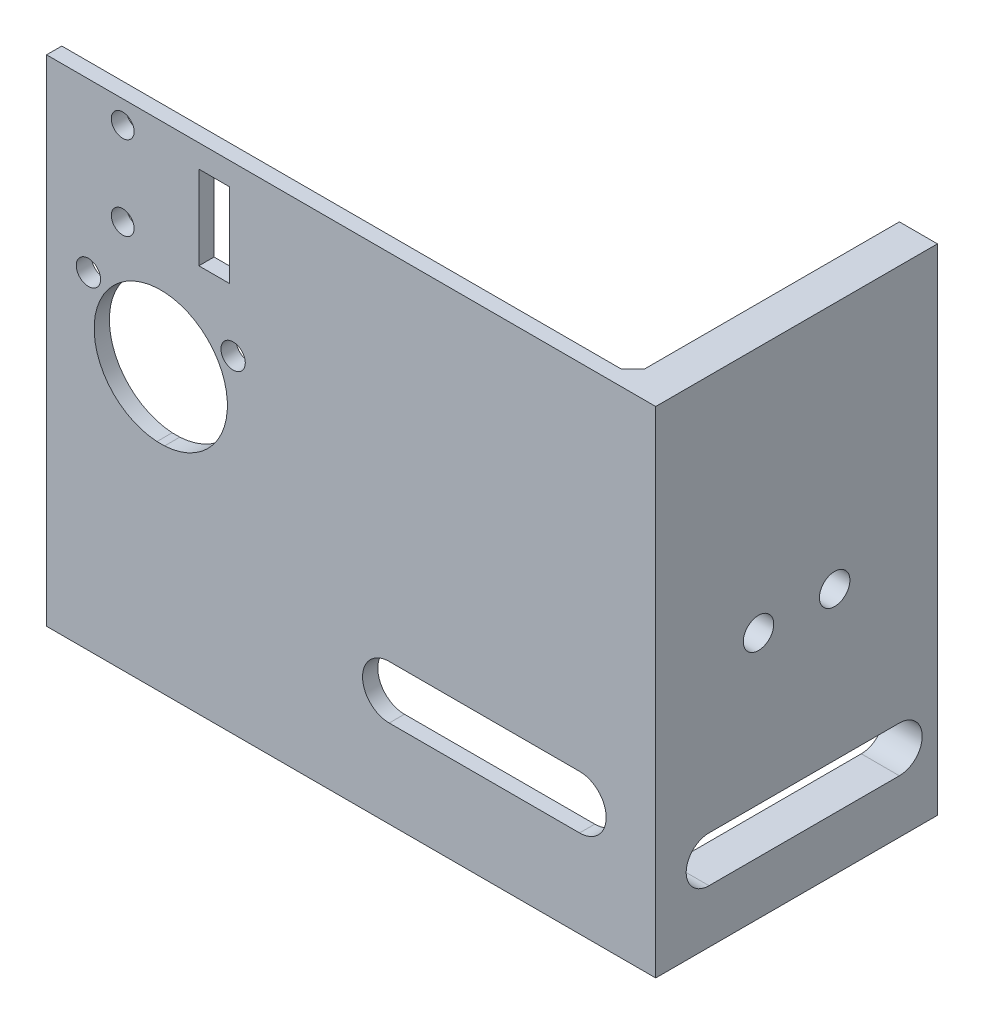
from build123d import *

# Parameters (mm, degrees)
SKETCH_1_W           = 30
SKETCH_1_H           = 48
EXTRUDE_1_DEPTH      = 2
SKETCH_2_R           = 1.6
CUT_EXTRUDE_1_DEPTH  = 2
SKETCH_3_R           = 8.75
CUT_EXTRUDE_2_DEPTH  = 2
SKETCH_4_W           = 30
SKETCH_4_H           = 2
EXTRUDE_2_DEPTH      = 17
SKETCH_14_W          = 0.5
SKETCH_14_H          = 2
CUT_EXTRUDE_6_DEPTH  = 67.738294854
SKETCH_15_W          = 2
SKETCH_15_H          = 65
EXTRUDE_7_DEPTH      = 50
SKETCH_16_W          = 5
SKETCH_16_H          = 65
EXTRUDE_8_DEPTH      = 35
SKETCH_17_R          = 2
CUT_EXTRUDE_7_DEPTH  = 35
SKETCH_18_W          = 2
SKETCH_18_H          = 28.264297395
EXTRUDE_9_DEPTH      = 1
EXTRUDE_10_REACH     = 87.675
SKETCH_19_W          = 2
SKETCH_19_H          = 19.264297395
CUT_EXTRUDE_8_DEPTH  = 6
CUT_EXTRUDE_9_DEPTH  = 6
CHAMFER_1_SIZE       = 1.5
SKETCH_22_R          = 1.5
SKETCH_22_W          = 4
SKETCH_22_H          = 11
CUT_EXTRUDE_10_DEPTH = 86.293610546


with BuildPart() as part:
    # 草图1 → 凸台-拉伸1 (new body)
    with BuildSketch(Plane.XY):
        Rectangle(SKETCH_1_W, SKETCH_1_H)
    extrude(amount=-EXTRUDE_1_DEPTH)

    # 草图2 → 切除-拉伸1 (cut)
    with BuildSketch(Plane.XY):
        with Locations((-9.5, 19)):
            Circle(SKETCH_2_R)
        with Locations((9.5, 19)):
            Circle(SKETCH_2_R)
    extrude(amount=-CUT_EXTRUDE_1_DEPTH, mode=Mode.SUBTRACT)

    # 草图3 → 切除-拉伸2 (cut)
    with BuildSketch(Plane.XY):
        with Locations((0, 13)):
            Circle(SKETCH_3_R)
    extrude(amount=-CUT_EXTRUDE_2_DEPTH, mode=Mode.SUBTRACT)

    # 草图4 → 凸台-拉伸2 (add)
    with BuildSketch(Plane(origin=(0, 24, 0), x_dir=(1, 0, 0), z_dir=(0, 1, 0))):
        with Locations((0, 1)):
            Rectangle(SKETCH_4_W, SKETCH_4_H)
    extrude(amount=EXTRUDE_2_DEPTH)

    # 草图14 → 切除-拉伸6 (cut, through all)
    with BuildSketch(Plane.XZ.offset(24)):
        with Locations((-0.25, -1)):
            Rectangle(SKETCH_14_W, SKETCH_14_H)
    extrude(amount=-CUT_EXTRUDE_6_DEPTH, mode=Mode.SUBTRACT)


with BuildPart() as cut_extrude_6_piece_1:
    # of the separate pieces the step leaves, piece 1, a body of its own (cut_extrude_6_pieces)
    add(part.part.solids().sort_by_distance((15, -24, 0))[0])

    # 草图15 → 凸台-拉伸7 (add)
    with BuildSketch(Plane(origin=(15, 0, 0), x_dir=(0, 0, -1), z_dir=(1, 0, 0))):
        with Locations((1, 8.5)):
            Rectangle(SKETCH_15_W, SKETCH_15_H)
    extrude(amount=EXTRUDE_7_DEPTH)

    # 草图16 → 凸台-拉伸8 (add)
    with BuildSketch(Plane(origin=(0, 0, -2), x_dir=(-1, 0, 0), z_dir=(0, 0, -1))):
        with Locations((-62.5, 8.5)):
            Rectangle(SKETCH_16_W, SKETCH_16_H)
    extrude(amount=EXTRUDE_8_DEPTH)

    # 草图17 → 切除-拉伸7 (cut)
    with BuildSketch(Plane(origin=(65, 0, 0), x_dir=(0, 0, -1), z_dir=(1, 0, 0))):
        with Locations(Location((13.5, 8.5, 0), (0, 0, 90))):
            Circle(SKETCH_17_R)
        with Locations(Location((23.5, 8.5, 0), (0, 0, 90))):
            Circle(SKETCH_17_R)
    extrude(amount=-CUT_EXTRUDE_7_DEPTH, mode=Mode.SUBTRACT)



with BuildPart() as cut_extrude_6_piece_2:
    # of the separate pieces the step leaves, piece 2, a body of its own (cut_extrude_6_pieces)
    add(part.part.solids().sort_by_distance((-15, -24, 0))[0])


with BuildPart() as cut_extrude_6_piece_1_1:
    add(cut_extrude_6_piece_1.part)

    add(cut_extrude_6_piece_2.part)  # 凸台-拉伸9 merges 切除-拉伸6 piece 2
    # 草图18 → 凸台-拉伸9 (add)
    with BuildSketch(Plane(origin=(-0.5, 0, 0), x_dir=(0, 0, -1), z_dir=(1, 0, 0))):
        with Locations((1, -9.867851303)):
            Rectangle(SKETCH_18_W, SKETCH_18_H)
    extrude(amount=EXTRUDE_9_DEPTH)

    # 草图19 → 凸台-拉伸10 (add, up to next)
    with BuildSketch(Plane(origin=(-0.5, 0, 0), x_dir=(0, 0, -1), z_dir=(1, 0, 0)), mode=Mode.PRIVATE) as extrude_10_sk1:
        with Locations((1, 31.367851303)):
            Rectangle(SKETCH_19_W, SKETCH_19_H)
    extrude_10_tool1 = extrude(extrude_10_sk1.sketch, amount=EXTRUDE_10_REACH, mode=Mode.PRIVATE) - cut_extrude_6_piece_1_1.part
    add(extrude_10_tool1.solids().sort_by_distance((-0.5, 31.367851, -1))[0])

    # 草图20 → 切除-拉伸8 (cut)
    with BuildSketch(Plane.XY):
        with BuildLine():
            Line((30, -5.5), (55, -5.5))
            ThreePointArc((55, -5.5), (58.5, -9), (55, -12.5))
            Line((55, -12.5), (30, -12.5))
            ThreePointArc((30, -12.5), (26.5, -9), (30, -5.5))
        make_face()
    extrude(amount=-CUT_EXTRUDE_8_DEPTH, mode=Mode.SUBTRACT)

    # 草图21 → 切除-拉伸9 (cut)
    with BuildSketch(Plane(origin=(65, 0, 0), x_dir=(0, 0, -1), z_dir=(1, 0, 0))):
        with BuildLine():
            Line((7, -11), (32, -11))
            ThreePointArc((32, -11), (35, -14), (32, -17))
            Line((32, -17), (7, -17))
            ThreePointArc((7, -17), (4, -14), (7, -11))
        make_face()
    extrude(amount=-CUT_EXTRUDE_9_DEPTH, mode=Mode.SUBTRACT)

    # 倒角1
    chamfer_1_edges = [cut_extrude_6_piece_1_1.edges().sort_by_distance(p)[0] for p in [
        (60, 8.5, -2),
    ]]
    chamfer(chamfer_1_edges, length=CHAMFER_1_SIZE - 0.0001)  # a hair under: the kernel refuses the full size

    # 草图22 → 切除-拉伸10 (cut, through all)
    with BuildSketch(Plane.XY):
        with Locations((-5, 38)):
            Circle(SKETCH_22_R)
        with Locations((-5, 27)):
            Circle(SKETCH_22_R)
        with Locations((7, 32.5)):
            Rectangle(SKETCH_22_W, SKETCH_22_H)
    extrude(amount=-CUT_EXTRUDE_10_DEPTH, mode=Mode.SUBTRACT)


solid = cut_extrude_6_piece_1_1.part
